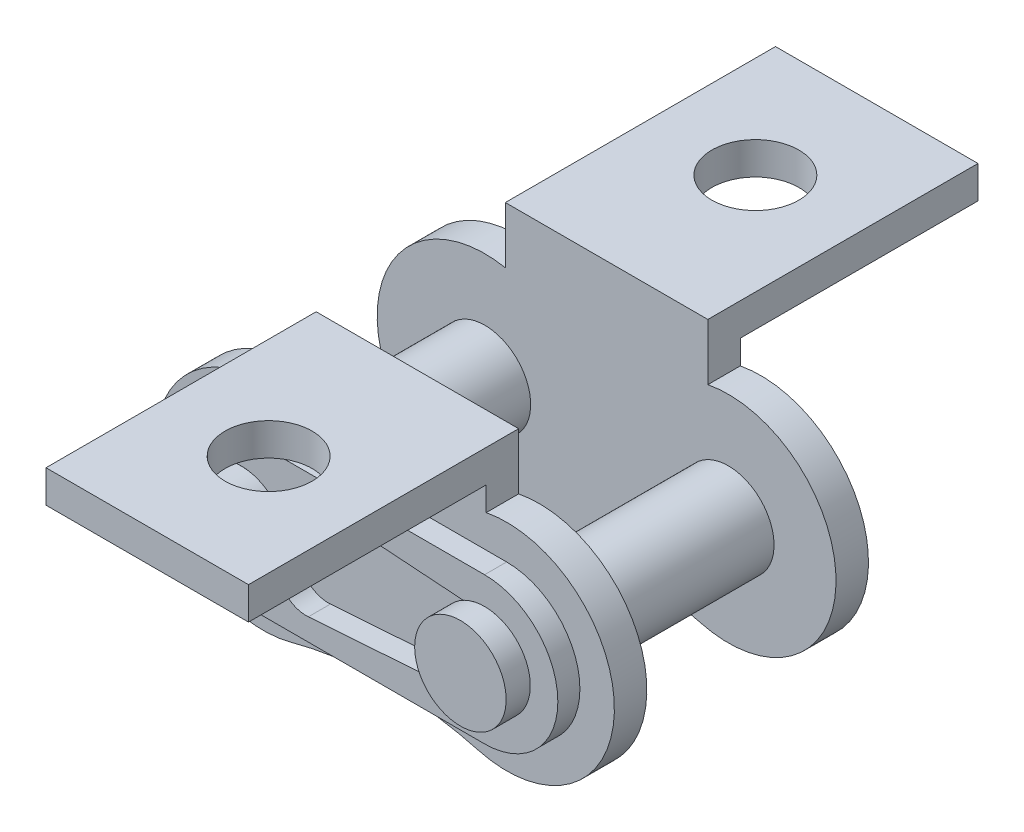
from build123d import *

# Parameters (mm, degrees)
SKETCH4_R                  = 2.54
SKETCH4_R_2                = 1.8161
BOSS_EXTRUDE1_DEPTH        = 2.38125
SKETCH5_R                  = 1.7907
BOSS_EXTRUDE2_DEPTH        = 1.27
LPATTERN1_COUNT            = 2
LPATTERN1_PITCH            = 9.525
SKETCH7_R                  = 1.7907
BOSS_EXTRUDE3_DEPTH        = 1.27
MIRROR1_START              = 3.70205
MIRROR1_OUTLINE_R          = 1.7907
MIRROR1_DEPTH              = 1.27
BOSS_EXTRUDE4_DEPTH        = 6.7818
BOSS_EXTRUDE4_DEPTH_BACK   = 5.9182
SKETCH8_R                  = 1.7907
BOSS_EXTRUDE4_2_DEPTH      = 6.7818
BOSS_EXTRUDE4_2_DEPTH_BACK = 5.9182
BOSS_EXTRUDE5_DEPTH        = 0.8636
SKETCH12_R                 = 1.7907
SKETCH12_R_2               = 1.522095
CUT_EXTRUDE1_DEPTH         = 0.8636
SKETCH13_W                 = 7.9248
SKETCH13_H                 = 10.57275
SKETCH13_R                 = 1.7018
BOSS_EXTRUDE6_DEPTH        = 1.27
BOSS_EXTRUDE6_2_DEPTH      = 1.27
BOSS_EXTRUDE7_REACH        = 27.151
SKETCH14_W                 = 7.9248
SKETCH14_H                 = 1.27
BOSS_EXTRUDE8_REACH        = 27.151
SKETCH15_W                 = 7.9248
SKETCH15_H                 = 1.27


# Read off the part's stored shape, not the designer's step: Mirror1
with BuildPart() as part:
    # Sketch4 → Boss-Extrude1 (new, symmetric)
    with BuildSketch(Plane.XY):
        with Locations(Location((4.7625, 0, 0), (0, 0, 180))):
            Circle(SKETCH4_R)
        with Locations(Location((4.7625, 0, 0), (0, 0, 180))):
            Circle(SKETCH4_R_2, mode=Mode.SUBTRACT)
    extrude(amount=BOSS_EXTRUDE1_DEPTH, both=True)


with BuildPart() as body_2:
    # Sketch5 → Boss-Extrude2 (new body)
    with BuildSketch(Plane.XY.offset(2.38125)):
        with BuildLine():
            ThreePointArc((-3.66203184, 4.070257828), (-8.9789, 0), (-3.66203184, -4.070257828))
            ThreePointArc((-3.66203184, -4.070257828), (0, -3.58394), (3.66203184, -4.070257828))
            ThreePointArc((3.66203184, -4.070257828), (8.9789, 0), (3.66203184, 4.070257828))
            ThreePointArc((3.66203184, 4.070257828), (0, 3.58394), (-3.66203184, 4.070257828))
        make_face()
        with Locations((-4.7625, 0)):
            Circle(SKETCH5_R, mode=Mode.SUBTRACT)
        with Locations((4.7625, 0)):
            Circle(SKETCH5_R, mode=Mode.SUBTRACT)
    extrude(amount=BOSS_EXTRUDE2_DEPTH)


with BuildPart() as lpattern1_1:
    # LPattern1: pattern copy
    add(part.part.moved(Location(Vector(1, 0, 0) * (1 * LPATTERN1_PITCH))))


with BuildPart() as body_4:
    # Sketch7 → Boss-Extrude3 (new body)
    with BuildSketch(Plane.XY.offset(-3.70205)):
        with BuildLine():
            ThreePointArc((5.86296816, 4.070257828), (0.5461, 0), (5.86296816, -4.070257828))
            ThreePointArc((5.86296816, -4.070257828), (9.525, -3.58394), (13.18703184, -4.070257828))
            ThreePointArc((13.18703184, -4.070257828), (18.5039, 0), (13.18703184, 4.070257828))
            ThreePointArc((13.18703184, 4.070257828), (9.525, 3.58394), (5.86296816, 4.070257828))
        make_face()
        with Locations((4.7625, 0)):
            Circle(SKETCH7_R, mode=Mode.SUBTRACT)
        with Locations((14.2875, 0)):
            Circle(SKETCH7_R, mode=Mode.SUBTRACT)
    extrude(amount=-BOSS_EXTRUDE3_DEPTH)


with BuildPart() as body_5:
    # Mirror1 outline → Mirror1 (new body)
    with BuildSketch(Plane.XY.offset(MIRROR1_START)):
        with BuildLine():
            ThreePointArc((5.86296816, 4.070257828), (0.5461, 0), (5.86296816, -4.070257828))
            ThreePointArc((5.86296816, -4.070257828), (9.525, -3.58394), (13.18703184, -4.070257828))
            ThreePointArc((13.18703184, -4.070257828), (18.5039, 0), (13.18703184, 4.070257828))
            ThreePointArc((13.18703184, 4.070257828), (9.525, 3.58394), (5.86296816, 4.070257828))
        make_face()
        with Locations((4.7625, 0)):
            Circle(MIRROR1_OUTLINE_R, mode=Mode.SUBTRACT)
        with Locations((14.2875, 0)):
            Circle(MIRROR1_OUTLINE_R, mode=Mode.SUBTRACT)
    extrude(amount=MIRROR1_DEPTH)


with BuildPart() as body_3:
    # Sketch8 → Boss-Extrude4 (new, two sides: drawn at the far end of the back side and taken through both)
    with BuildSketch(Plane.XY.offset(-BOSS_EXTRUDE4_DEPTH_BACK)):
        with Locations(Location((4.7625, 0, 0), (0, 0, 180))):
            Circle(SKETCH8_R)
    extrude(amount=BOSS_EXTRUDE4_DEPTH + BOSS_EXTRUDE4_DEPTH_BACK)


with BuildPart() as body_4_2:
    # Sketch8 → Boss-Extrude4 2 (new, two sides: drawn at the far end of the back side and taken through both)
    with BuildSketch(Plane.XY.offset(-BOSS_EXTRUDE4_2_DEPTH_BACK)):
        with Locations(Location((14.2875, 0, 0), (0, 0, 180))):
            Circle(SKETCH8_R)
    extrude(amount=BOSS_EXTRUDE4_2_DEPTH + BOSS_EXTRUDE4_2_DEPTH_BACK)


with BuildPart() as body_5_2:
    # Sketch10 → Boss-Extrude5 (new body)
    with BuildSketch(Plane.XY.offset(4.97205)):
        with BuildLine():
            Line((14.2875, -2.867152), (3.156330824, -2.867152))
            ThreePointArc((3.156330824, -2.867152), (2.625769403, -2.506843945), (2.765041086, -1.880808232))
            Line((2.765041086, -1.880808232), (3.654344952, -1.043439303))
            ThreePointArc((3.654344952, -1.043439303), (4.7625, -1.522095), (5.870655048, -1.043439303))
            Line((5.870655048, -1.043439303), (6.503729881, -1.676514136))
            ThreePointArc((6.503729881, -1.676514136), (6.911155975, -1.938579406), (7.390574638, -2.008091804))
            Line((7.390574638, -2.008091804), (14.39367598, -1.518387253))
            ThreePointArc((14.39367598, -1.518387253), (15.809595, 0), (14.39367598, 1.518387253))
            Line((14.39367598, 1.518387253), (7.390574638, 2.008091804))
            ThreePointArc((7.390574638, 2.008091804), (6.911155975, 1.938579406), (6.503729881, 1.676514136))
            Line((6.503729881, 1.676514136), (5.870655048, 1.043439303))
            ThreePointArc((5.870655048, 1.043439303), (4.7625, 1.522095), (3.654344952, 1.043439303))
            Line((3.654344952, 1.043439303), (2.765041086, 1.880808232))
            ThreePointArc((2.765041086, 1.880808232), (2.625769403, 2.506843945), (3.156330824, 2.867152))
            Line((3.156330824, 2.867152), (14.2875, 2.867152))
            ThreePointArc((14.2875, 2.867152), (17.154652, 0), (14.2875, -2.867152))
        make_face()
    extrude(amount=BOSS_EXTRUDE5_DEPTH)


with BuildPart() as cut_extrude1_tool:
    # Sketch12 → Cut-Extrude1 (new body)
    # profile 1 of 2: a face of its own
    with BuildSketch(Plane.XY.offset(4.97205)):
        with Locations(Location((4.7625, 0, 0), (0, 0, 180))):
            Circle(SKETCH12_R)
        with Locations((4.7625, 0)):
            Circle(SKETCH12_R_2, mode=Mode.SUBTRACT)
    # profile 2 of 2: a face of its own
    with BuildSketch(Plane.XY.offset(4.97205)):
        with Locations(Location((14.2875, 0, 0), (0, 0, 180))):
            Circle(SKETCH12_R)
        with Locations((14.2875, 0)):
            Circle(SKETCH12_R_2, mode=Mode.SUBTRACT)
    extrude(amount=CUT_EXTRUDE1_DEPTH)


with BuildPart() as body_3_1:
    add(body_3.part)

    # Cut-Extrude1: cut by cut_extrude1_tool
    add(cut_extrude1_tool.part, mode=Mode.SUBTRACT)


with BuildPart() as body_4_2_1:
    add(body_4_2.part)

    # Cut-Extrude1: cut by cut_extrude1_tool
    add(cut_extrude1_tool.part, mode=Mode.SUBTRACT)


with BuildPart() as body_5_2_1:
    add(body_5_2.part)

    # Cut-Extrude1: cut by cut_extrude1_tool
    add(cut_extrude1_tool.part, mode=Mode.SUBTRACT)


with BuildPart() as body_4_1:
    add(body_4.part)

    # Combine3: union body 5, body 4 2, body 3
    add(body_5.part)
    add(body_4_2_1.part)
    add(body_3_1.part)

    # Sketch14 → Boss-Extrude7 (add, up to next)
    with BuildSketch(Plane.XZ.offset(-5.08), mode=Mode.PRIVATE) as boss_extrude7_sk1:
        with Locations((9.525, -4.33705)):
            Rectangle(SKETCH14_W, SKETCH14_H)
    boss_extrude7_tool1 = extrude(boss_extrude7_sk1.sketch, amount=BOSS_EXTRUDE7_REACH, mode=Mode.PRIVATE) - body_4_1.part


with BuildPart() as body_3_2:
    # Sketch13 → Boss-Extrude6 (new body)
    with BuildSketch(Plane(origin=(0, 6.35, 0), x_dir=(-1, 0, 0), z_dir=(0, 1, 0))):
        with Locations((-9.525, -8.988425)):
            Rectangle(SKETCH13_W, SKETCH13_H)
        with Locations(Location((-9.525, -9.525, 0), (0, 0, 90))):
            Circle(SKETCH13_R, mode=Mode.SUBTRACT)
    extrude(amount=-BOSS_EXTRUDE6_DEPTH)


with BuildPart() as body_4_3:
    # Sketch13 → Boss-Extrude6 2 (new body)
    with BuildSketch(Plane(origin=(0, 6.35, 0), x_dir=(-1, 0, 0), z_dir=(0, 1, 0))):
        with Locations((-9.525, 8.988425)):
            Rectangle(SKETCH13_W, SKETCH13_H)
        with Locations(Location((-9.525, 9.525, 0), (0, 0, 90))):
            Circle(SKETCH13_R, mode=Mode.SUBTRACT)
    extrude(amount=-BOSS_EXTRUDE6_2_DEPTH)


with BuildPart() as body_4_4:
    add(body_4_1.part)

    add(body_3_2.part)  # Boss-Extrude7 merges body 3 2
    add(boss_extrude7_tool1.solids().sort_by_distance((9.525, 5.08, -4.33705))[0])

    # Sketch15 → Boss-Extrude8 (add, up to next)
    with BuildSketch(Plane.XZ.offset(-5.08), mode=Mode.PRIVATE) as boss_extrude8_sk1:
        with Locations((9.525, 4.33705)):
            Rectangle(SKETCH15_W, SKETCH15_H)
    boss_extrude8_tool1 = extrude(boss_extrude8_sk1.sketch, amount=BOSS_EXTRUDE8_REACH, mode=Mode.PRIVATE) - body_4_4.part

    add(body_4_3.part)  # Boss-Extrude8 merges body 4 3
    add(boss_extrude8_tool1.solids().sort_by_distance((9.525, 5.08, 4.33705))[0])


solid = Compound([body_5_2_1.part, body_4_4.part])
